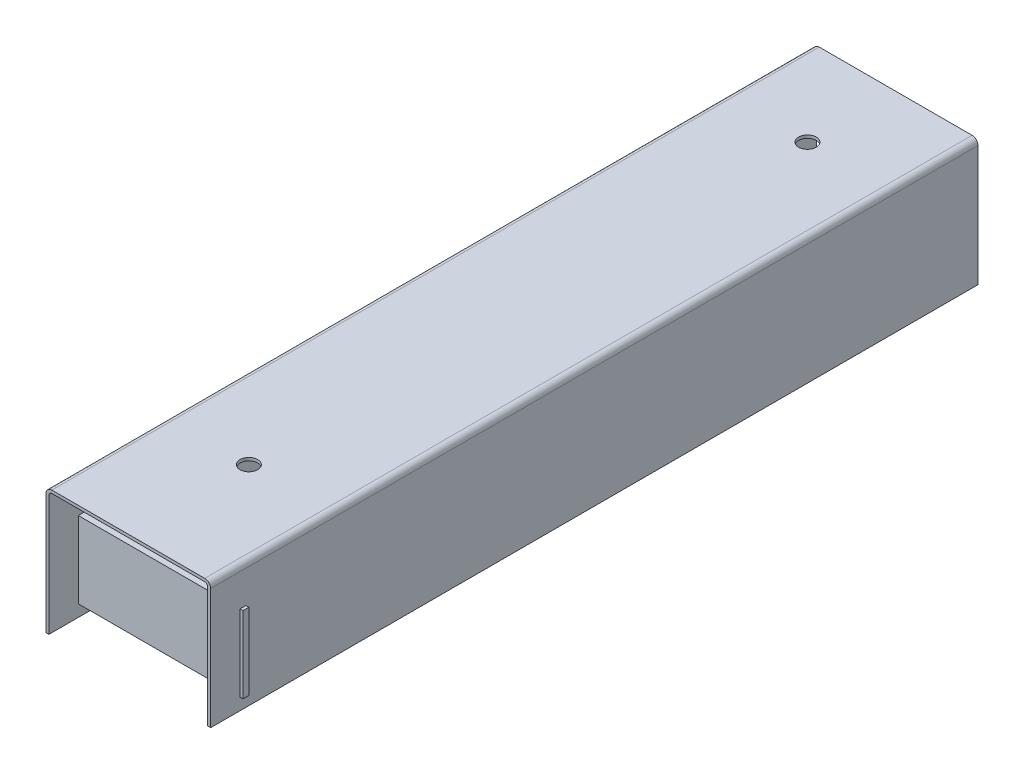
from build123d import *

# Parameters (mm, degrees)
BOSS_EXTRUDE1_DEPTH      = 261
FILLET1_R                = 2
FILLET2_R                = 1
BOSS_EXTRUDE2_DEPTH      = 56
BOSS_EXTRUDE2_DEPTH_BACK = 2
SKETCH2_W                = 2
SKETCH2_H                = 26
SKETCH3_R                = 3
CUT_EXTRUDE1_DEPTH       = 11
SKETCH4_W                = 30
SKETCH4_H                = 40
CUT_EXTRUDE2_DEPTH       = 10


with BuildPart() as part:
    # Sketch1 → Boss-Extrude1 (new body)
    with BuildSketch(Plane.XY):
        Polygon((28, 21.5), (-28, 21.5), (-28, -21.5), (-27, -21.5), (-27, -20.5), (-27, 20.5), (27, 20.5), (27, -20.5), (27, -21.5), (28, -21.5), align=None)
    extrude(amount=BOSS_EXTRUDE1_DEPTH)

    # Fillet1
    fillet1_edges = [part.edges().sort_by_distance(p)[0] for p in [
        (-28, 21.5, 130.5),
        (28, 21.5, 130.5),
    ]]
    fillet(fillet1_edges, radius=FILLET1_R)

    # Fillet2
    fillet2_edges = [part.edges().sort_by_distance(p)[0] for p in [
        (27, 20.5, 130.5),
        (-27, 20.5, 130.5),
    ]]
    fillet(fillet2_edges, radius=FILLET2_R)

    # Sketch2 → Boss-Extrude2 (add, two sides: drawn at the far end of the back side and taken through both)
    with BuildSketch(Plane(origin=(-27, 0, 0), x_dir=(0, 0, -1), z_dir=(1, 0, 0)).offset(-BOSS_EXTRUDE2_DEPTH_BACK)):
        with Locations((-250, -4.5)):
            Rectangle(SKETCH2_W, SKETCH2_H)
    extrude(amount=BOSS_EXTRUDE2_DEPTH + BOSS_EXTRUDE2_DEPTH_BACK)

    # Sketch3 → Cut-Extrude1 (cut)
    with BuildSketch(Plane(origin=(0, 21.5, 0), x_dir=(1, 0, 0), z_dir=(0, 1, 0))):
        with Locations((0, -30)):
            Circle(SKETCH3_R)
        with Locations((0, -220)):
            Circle(SKETCH3_R)
    extrude(amount=-CUT_EXTRUDE1_DEPTH, mode=Mode.SUBTRACT)

    # Sketch4 → Cut-Extrude2 (cut)
    with BuildSketch(Plane.ZY.offset(28)):
        with Locations((221, -3.5)):
            Rectangle(SKETCH4_W, SKETCH4_H)
    extrude(amount=-CUT_EXTRUDE2_DEPTH, mode=Mode.SUBTRACT)


solid = part.part
